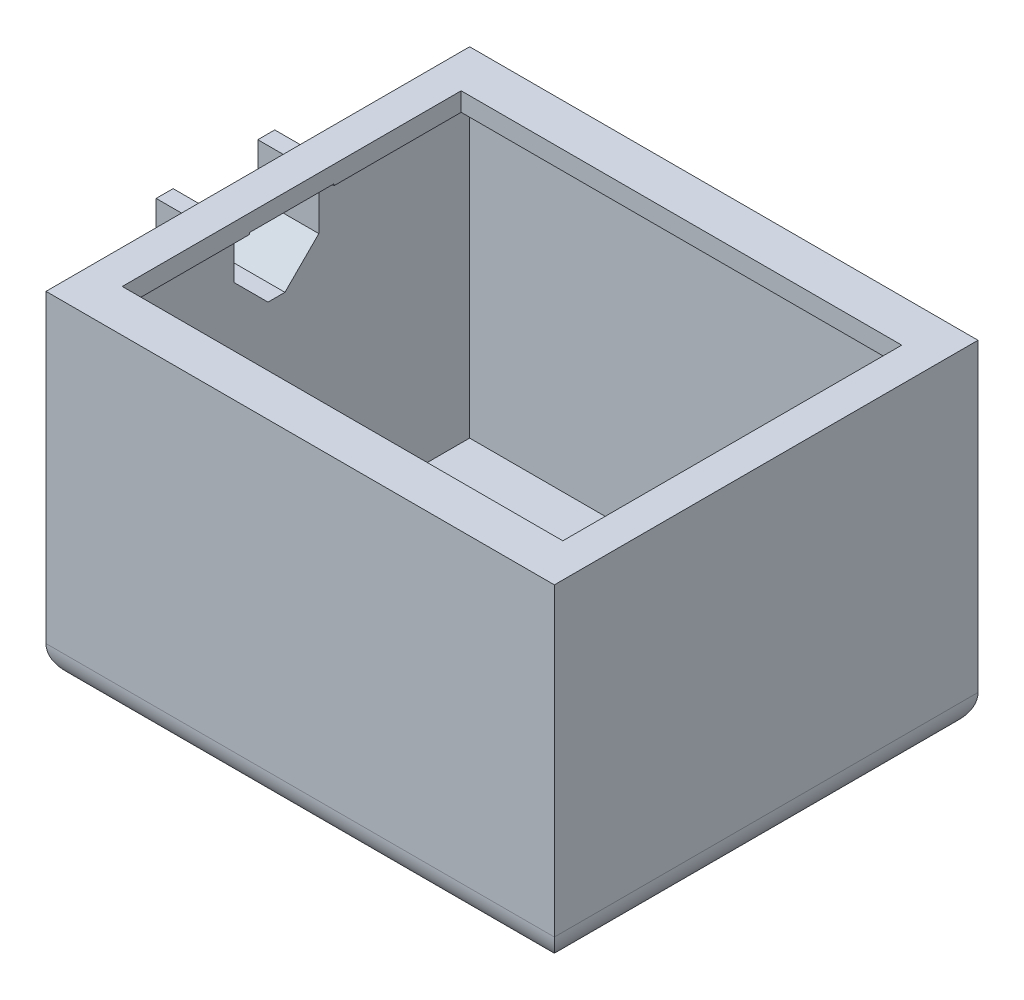
from build123d import *

# Parameters (mm, degrees)
SKETCH1_W           = 60
SKETCH1_H           = 50
BOSS_EXTRUDE1_DEPTH = 40
SHELL1_T            = 2.2
SKETCH2_W           = 52
SKETCH2_H           = 40
CUT_EXTRUDE1_DEPTH  = 10
SKETCH3_W           = 10
SKETCH3_H           = 10
CUT_EXTRUDE2_DEPTH  = 5
BOSS_EXTRUDE2_DEPTH = 5
CHAMFER3_SIZE       = 5
CHAMFER4_SIZE       = 4
FILLET1_R           = 4


with BuildPart() as part:
    # Sketch1 → Boss-Extrude1 (new body)
    with BuildSketch(Plane(origin=(0, 0, 0), x_dir=(1, 0, 0), z_dir=(0, 1, 0))):
        Rectangle(SKETCH1_W, SKETCH1_H)
    extrude(amount=BOSS_EXTRUDE1_DEPTH)

    # Shell1 (no face opened: a closed hollow body)
    add(offset(amount=-SHELL1_T, mode=Mode.PRIVATE), mode=Mode.SUBTRACT)

    # Sketch2 → Cut-Extrude1 (cut)
    with BuildSketch(Plane(origin=(0, 40, 0), x_dir=(1, 0, 0), z_dir=(0, 1, 0))):
        Rectangle(SKETCH2_W, SKETCH2_H)
    extrude(amount=-CUT_EXTRUDE1_DEPTH, mode=Mode.SUBTRACT)

    # Sketch3 → Cut-Extrude2 (cut)
    with BuildSketch(Plane(origin=(-30, 0, 0), x_dir=(0, 0, -1), z_dir=(1, 0, 0))):
        with Locations((0, 33)):
            Rectangle(SKETCH3_W, SKETCH3_H)
    extrude(amount=CUT_EXTRUDE2_DEPTH, mode=Mode.SUBTRACT)

    # Sketch4 → Boss-Extrude2 (add)
    with BuildSketch(Plane(origin=(-30, 0, 0), x_dir=(0, 0, -1), z_dir=(1, 0, 0))):
        Polygon((-5, 38), (-7, 38), (-7, 26), (7, 26), (7, 38), (5, 38), (5, 28), (-5, 28), align=None)
    extrude(amount=-BOSS_EXTRUDE2_DEPTH)

    # Chamfer3
    chamfer3_edges = [part.edges().sort_by_distance(p)[0] for p in [
        (-30, 26, 0),
    ]]
    chamfer(chamfer3_edges, length=CHAMFER3_SIZE - 0.0001)  # a hair under: the kernel refuses the full size

    # Chamfer4
    chamfer4_edges = [part.edges().sort_by_distance(p)[0] for p in [
        (-31.4, 28, 5),
        (-31.4, 28, -5),
    ]]
    chamfer(chamfer4_edges, length=CHAMFER4_SIZE)

    # Fillet1
    fillet1_edges = [part.edges().sort_by_distance(p)[0] for p in [
        (0, 0, 25),
        (-30, 0, 0),
        (0, 0, -25),
        (30, 0, 0),
    ]]
    fillet(fillet1_edges, radius=FILLET1_R)


solid = part.part
